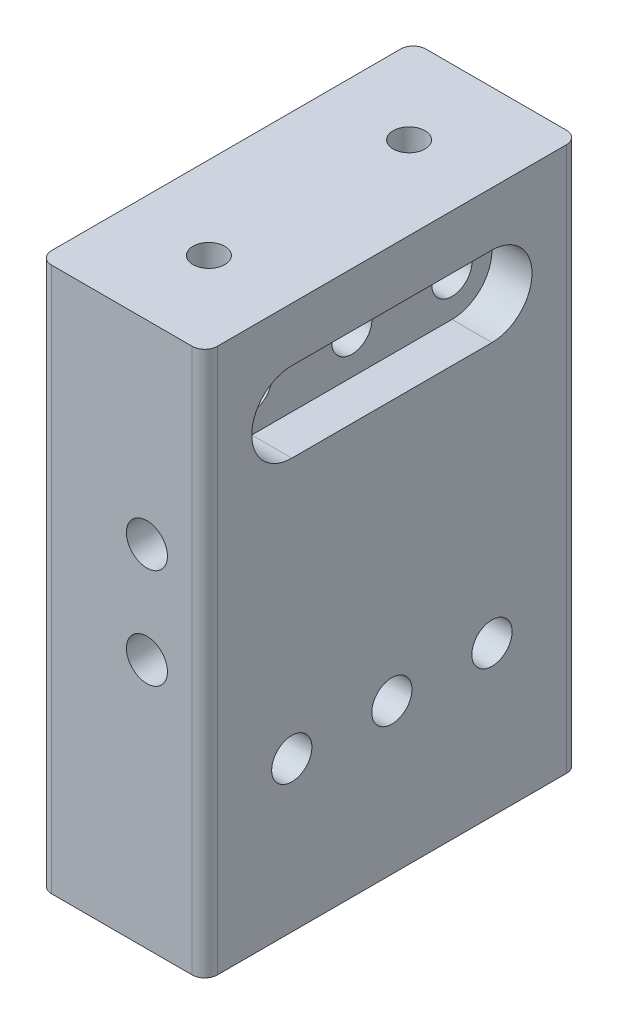
from build123d import *

# Parameters (mm, degrees)
SKETCH1_W           = 21.0312
SKETCH1_H           = 47.4853
BOSS_EXTRUDE1_DEPTH = 31.75
SKETCH2_R           = 2.6035
CUT_EXTRUDE1_DEPTH  = 59.081787674
SKETCH4_R           = 2.5527
CUT_EXTRUDE3_DEPTH  = 45.878584007
FILLET1_R           = 1.5875
CUT_EXTRUDE5_DEPTH  = 5.08
BOSS_EXTRUDE2_DEPTH = 5.588
SKETCH9_R           = 2.0193
CUT_EXTRUDE6_DEPTH  = 5.08
SKETCH10_R          = 2.5527
CUT_EXTRUDE7_DEPTH  = 49.991336443


with BuildPart() as part:
    # Sketch1 → Boss-Extrude1 (new, symmetric)
    with BuildSketch(Plane(origin=(0, 0, 0), x_dir=(1, 0, 0), z_dir=(0, 1, 0))):
        Rectangle(SKETCH1_W, SKETCH1_H)
    extrude(amount=BOSS_EXTRUDE1_DEPTH, both=True)

    # Sketch2 → Cut-Extrude1 (cut, through all)
    with BuildSketch(Plane.XY.offset(23.74265)):
        with Locations((3.175, 0)):
            Circle(SKETCH2_R)
        with Locations((3.175, 12.7)):
            Circle(SKETCH2_R)
    extrude(amount=-CUT_EXTRUDE1_DEPTH, mode=Mode.SUBTRACT)

    # Sketch4 → Cut-Extrude3 (cut, through all)
    with BuildSketch(Plane(origin=(10.5156, 0, 0), x_dir=(0, 0, -1), z_dir=(1, 0, 0))):
        with Locations((-12.7, 25.4)):
            Circle(SKETCH4_R)
        with Locations((12.7, 25.4)):
            Circle(SKETCH4_R)
        with Locations((0, 25.4)):
            Circle(SKETCH4_R)
    extrude(amount=-CUT_EXTRUDE3_DEPTH, mode=Mode.SUBTRACT)

    # Fillet1
    fillet1_edges = [part.edges().sort_by_distance(p)[0] for p in [
        (10.5156, 0, 23.74265),
        (-10.5156, 0, 23.74265),
        (-10.5156, 0, -23.74265),
        (10.5156, 0, -23.74265),
    ]]
    fillet(fillet1_edges, radius=FILLET1_R)

    # Sketch7 → Cut-Extrude5 (cut)
    with BuildSketch(Plane(origin=(10.5156, 0, 0), x_dir=(0, 0, -1), z_dir=(1, 0, 0))):
        with BuildLine():
            Line((-12.7, 30.48), (12.7, 30.48))
            ThreePointArc((12.7, 30.48), (17.78, 25.4), (12.7, 20.32))
            Line((12.7, 20.32), (-12.7, 20.32))
            ThreePointArc((-12.7, 20.32), (-17.78, 25.4), (-12.7, 30.48))
        make_face()
    extrude(amount=-CUT_EXTRUDE5_DEPTH, mode=Mode.SUBTRACT)

    # Sketch8 → Boss-Extrude2 (add)
    with BuildSketch(Plane(origin=(0, 31.75, 0), x_dir=(1, 0, 0), z_dir=(0, 1, 0))):
        with BuildLine():
            Line((-8.9281, -23.74265), (8.9281, -23.74265))
            ThreePointArc((8.9281, -23.74265), (10.050632015, -23.277682015), (10.5156, -22.15515))
            Line((10.5156, -22.15515), (10.5156, 22.15515))
            ThreePointArc((10.5156, 22.15515), (10.050632015, 23.277682015), (8.9281, 23.74265))
            Line((8.9281, 23.74265), (-8.9281, 23.74265))
            ThreePointArc((-8.9281, 23.74265), (-10.050632015, 23.277682015), (-10.5156, 22.15515))
            Line((-10.5156, 22.15515), (-10.5156, -22.15515))
            ThreePointArc((-10.5156, -22.15515), (-10.050632015, -23.277682015), (-8.9281, -23.74265))
        make_face()
    extrude(amount=BOSS_EXTRUDE2_DEPTH)

    # Sketch9 → Cut-Extrude6 (cut)
    with BuildSketch(Plane(origin=(0, 37.338, 0), x_dir=(1, 0, 0), z_dir=(0, 1, 0))):
        with Locations((0, 12.7)):
            Circle(SKETCH9_R)
        with Locations((0, -12.7)):
            Circle(SKETCH9_R)
    extrude(amount=-CUT_EXTRUDE6_DEPTH, mode=Mode.SUBTRACT)

    # Sketch10 → Cut-Extrude7 (cut, through all)
    with BuildSketch(Plane.ZY.offset(10.5156)):
        with Locations((-12.7, -12.7)):
            Circle(SKETCH10_R)
        with Locations((0, -12.7)):
            Circle(SKETCH10_R)
        with Locations((12.7, -12.7)):
            Circle(SKETCH10_R)
    extrude(amount=-CUT_EXTRUDE7_DEPTH, mode=Mode.SUBTRACT)


solid = part.part
